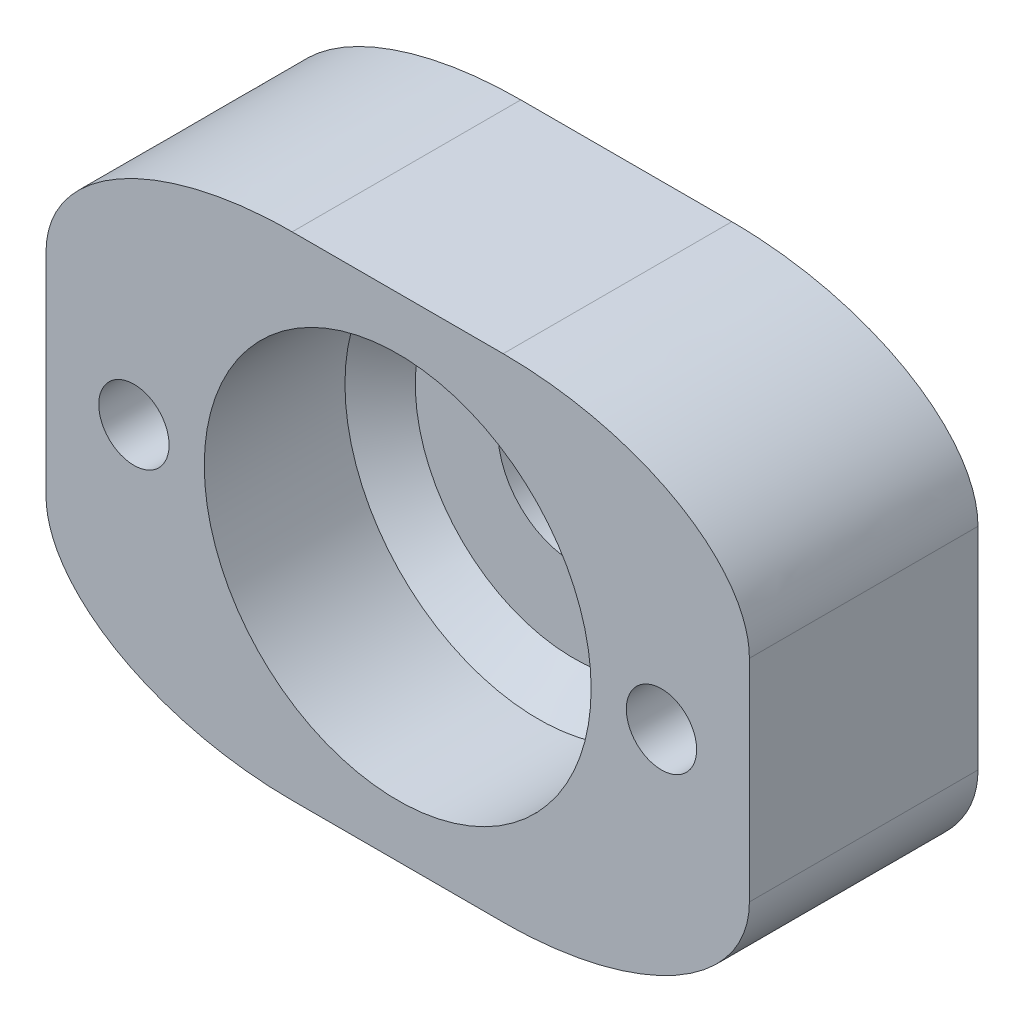
from build123d import *

# Parameters (mm, degrees)
SZKIC1_W                    = 40
SZKIC1_H                    = 28
SZKIC1_R                    = 11
DODANIE_WYCI_GNI_CIE1_DEPTH = 10
SZKIC2_W                    = 40
SZKIC2_H                    = 28
DODANIE_WYCI_GNI_CIE2_DEPTH = 3
SFAZOWANIE1_SIZE            = 2
SZKIC3_R                    = 4.3
WYTNIJ_WYCI_GNI_CIE1_DEPTH  = 3
SZKIC4_R                    = 2
WYTNIJ_WYCI_GNI_CIE2_DEPTH  = 6
ZAOKR_GLENIE1_SIZE          = 14
ZAOKR_GLENIE1_SIZE_2        = 8
ZAOKR_GLENIE2_SIZE          = 14
ZAOKR_GLENIE2_SIZE_2        = 8
SZKIC5_R                    = 2.6
WYTNIJ_WYCI_GNI_CIE3_DEPTH  = 7


with BuildPart() as part:
    # Szkic1 → Dodanie-wyciągnięcie1 (new body)
    with BuildSketch(Plane.XY):
        Rectangle(SZKIC1_W, SZKIC1_H)
        Circle(SZKIC1_R, mode=Mode.SUBTRACT)
    extrude(amount=DODANIE_WYCI_GNI_CIE1_DEPTH)

    # Szkic2 → Dodanie-wyciągnięcie2 (add)
    with BuildSketch(Plane(origin=(0, 0, 0), x_dir=(-1, 0, 0), z_dir=(0, 0, -1))):
        Rectangle(SZKIC2_W, SZKIC2_H)
    extrude(amount=DODANIE_WYCI_GNI_CIE2_DEPTH)

    # Sfazowanie1
    sfazowanie1_edges = [part.edges().sort_by_distance(p)[0] for p in [
        (-11, 0, 0),
    ]]
    chamfer(sfazowanie1_edges, length=SFAZOWANIE1_SIZE)

    # Szkic3 → Wytnij-wyciągnięcie1 (cut)
    with BuildSketch(Plane.XY):
        Circle(SZKIC3_R)
    extrude(amount=-WYTNIJ_WYCI_GNI_CIE1_DEPTH, mode=Mode.SUBTRACT)

    # Szkic4 → Wytnij-wyciągnięcie2 (cut)
    with BuildSketch(Plane.XY.offset(10)):
        with Locations((-15, 0)):
            Circle(SZKIC4_R)
        with Locations((15, 0)):
            Circle(SZKIC4_R)
    extrude(amount=-WYTNIJ_WYCI_GNI_CIE2_DEPTH, mode=Mode.SUBTRACT)

    # Zaokrąglenie1
    # an asymmetric fillet: 14, 8 mm, written as the material it takes off along each edge
    with BuildSketch(Plane(origin=(20, -14, -38), x_dir=(-1, 0, 0), z_dir=(0, 0, 1))) as zaokr_glenie1_piece_1:
        with BuildLine():
            Bezier((ZAOKR_GLENIE1_SIZE, 0), (0, 0), (0, -ZAOKR_GLENIE1_SIZE_2), weights=[1, 0.707106781, 1])
            Line((0, -ZAOKR_GLENIE1_SIZE_2), (0, 0))
            Line((0, 0), (ZAOKR_GLENIE1_SIZE, 0))
        make_face()
    extrude(amount=83, mode=Mode.SUBTRACT)
    with BuildSketch(Plane(origin=(-20, 14, 45), x_dir=(0, -1, 0), z_dir=(0, 0, -1))) as zaokr_glenie1_piece_2:
        with BuildLine():
            Bezier((ZAOKR_GLENIE1_SIZE_2, 0), (0, 0), (0, -ZAOKR_GLENIE1_SIZE), weights=[1, 0.707106781, 1])
            Line((0, -ZAOKR_GLENIE1_SIZE), (0, 0))
            Line((0, 0), (ZAOKR_GLENIE1_SIZE_2, 0))
        make_face()
    extrude(amount=83, mode=Mode.SUBTRACT)

    # Zaokrąglenie2
    # an asymmetric fillet: 14, 8 mm, written as the material it takes off along each edge
    with BuildSketch(Plane(origin=(20, 14, -38), x_dir=(-1, 0, 0), z_dir=(0, 0, 1))) as zaokr_glenie2_piece_1:
        with BuildLine():
            Bezier((ZAOKR_GLENIE2_SIZE, 0), (0, 0), (0, ZAOKR_GLENIE2_SIZE_2), weights=[1, 0.707106781, 1])
            Line((0, ZAOKR_GLENIE2_SIZE_2), (0, 0))
            Line((0, 0), (ZAOKR_GLENIE2_SIZE, 0))
        make_face()
    extrude(amount=83, mode=Mode.SUBTRACT)
    with BuildSketch(Plane(origin=(-20, -14, 45), x_dir=(1, 0, 0), z_dir=(0, 0, -1))) as zaokr_glenie2_piece_2:
        with BuildLine():
            Bezier((ZAOKR_GLENIE2_SIZE, 0), (0, 0), (0, -ZAOKR_GLENIE2_SIZE_2), weights=[1, 0.707106781, 1])
            Line((0, -ZAOKR_GLENIE2_SIZE_2), (0, 0))
            Line((0, 0), (ZAOKR_GLENIE2_SIZE, 0))
        make_face()
    extrude(amount=83, mode=Mode.SUBTRACT)

    # Szkic5 → Wytnij-wyciągnięcie3 (cut)
    with BuildSketch(Plane(origin=(0, 0, -3), x_dir=(-1, 0, 0), z_dir=(0, 0, -1))):
        with Locations((-15, 0)):
            Circle(SZKIC5_R)
        with Locations((15, 0)):
            Circle(SZKIC5_R)
    extrude(amount=-WYTNIJ_WYCI_GNI_CIE3_DEPTH, mode=Mode.SUBTRACT)


solid = part.part
